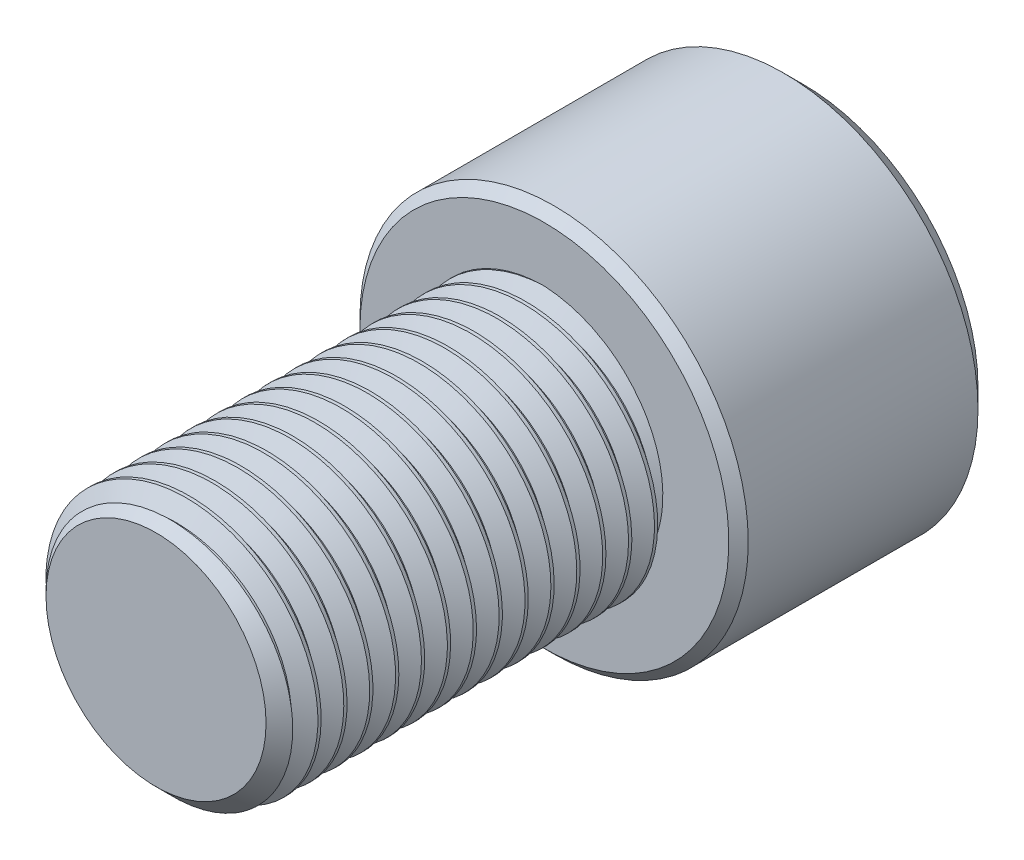
from build123d import *

# Parameters (mm, degrees)
SKETCH1_R          = 6.35
EXTRUDE1_DEPTH     = 19.05
CHAMFER3_SIZE      = 0.9525
CUT_SWEEP1_PITCH   = 1.27
SKETCH6_R          = 9.525
EXTRUDE2_DEPTH     = 12.7
CUT_EXTRUDE1_DEPTH = 7.14375
CHAMFER1_SIZE      = 0.9525
CHAMFER2_SIZE      = 0.47625


with BuildPart() as part:
    # Sketch1 → Extrude1 (new body)
    with BuildSketch(Plane.XY):
        Circle(SKETCH1_R)
    extrude(amount=-EXTRUDE1_DEPTH)

    # Chamfer3
    chamfer3_edges = [part.edges().sort_by_distance(p)[0] for p in [
        (-6.35, 0, 0),
    ]]
    chamfer(chamfer3_edges, length=CHAMFER3_SIZE)

    # Cut-Sweep1: the profile of Sketch3 profile screwed along a right-hand helix of 16 turns, 6 arcs to a turn; built about Z, then put on its axis
    cut_sweep1_z = Axis((0, 0, 0), (0, 0, 1))
    cut_sweep1_corners = [(6.3503, 0, -1.111423205), (5.525110803, 0, -0.635), (5.525110803, 0, -0.47625), (6.3503, 0, 0.000173205)]
    with BuildLine(mode=Mode.PRIVATE) as cut_sweep1_profile:
        Line(cut_sweep1_corners[0], cut_sweep1_corners[1])
        Line(cut_sweep1_corners[1], cut_sweep1_corners[2])
        Line(cut_sweep1_corners[2], cut_sweep1_corners[3])
        Line(cut_sweep1_corners[3], cut_sweep1_corners[0])
    cut_sweep1_cap = Face(cut_sweep1_profile.wire())
    cut_sweep1_turn_angles = [0, 30, 60, 90, 120, 150, 180, 210, 240, 270, 300, 330, 360]
    cut_sweep1_turn_weights = [1, 0.8660254037844387, 1, 0.8660254037844387, 1, 0.8660254037844387, 1, 0.8660254037844387, 1, 0.8660254037844387, 1, 0.8660254037844387, 1]
    cut_sweep1_turn_rails = [Edge.make_bspline([Vector(p[0], p[1], 0).rotate(cut_sweep1_z, cut_sweep1_turn_angles[k]) / cut_sweep1_turn_weights[k] + Vector(0, 0, p[2] + CUT_SWEEP1_PITCH * cut_sweep1_turn_angles[k] / 360) for k in range(13)], [0, 0, 0, 1, 1, 2, 2, 3, 3, 4, 4, 5, 5, 6, 6, 6], 2, cut_sweep1_turn_weights) for p in cut_sweep1_corners]
    cut_sweep1_turn_sides = [Face.make_surface_from_curves(cut_sweep1_turn_rails[p[0]], cut_sweep1_turn_rails[p[1]]) for p in [(0, 1), (1, 2), (2, 3), (3, 0)]]
    cut_sweep1 = Plane(origin=(0, 0, 0), x_dir=(0, 1, 0), z_dir=(0, 0, -1)) * Solid(Shell([*[p.moved(Location((0, 0, CUT_SWEEP1_PITCH * i))) for i in range(16) for p in cut_sweep1_turn_sides], cut_sweep1_cap, cut_sweep1_cap.rotate(cut_sweep1_z, 5760).moved(Location((0, 0, CUT_SWEEP1_PITCH * 5760 / 360)))]))
    add(cut_sweep1, mode=Mode.SUBTRACT)

    # Sketch6 → Extrude2 (add)
    with BuildSketch(Plane(origin=(0, 0, -19.05), x_dir=(-1, 0, 0), z_dir=(0, 0, -1))):
        Circle(SKETCH6_R)
    extrude(amount=EXTRUDE2_DEPTH)

    # Sketch7 → Cut-Extrude1 (cut)
    with BuildSketch(Plane(origin=(0, 0, -31.75), x_dir=(-1, 0, 0), z_dir=(0, 0, -1))):
        Polygon((0, 5.499261314), (-4.7625, 2.749630657), (-4.7625, -2.749630657), (0, -5.499261314), (4.7625, -2.749630657), (4.7625, 2.749630657), align=None)
    extrude(amount=-CUT_EXTRUDE1_DEPTH, mode=Mode.SUBTRACT)

    # Cut-Extrude2 cone 1 section (through the dimple's axis) → Cut-Extrude2 (revolve, cut)
    with BuildSketch(Plane(origin=(0, 0, -31.75), x_dir=(0, 1, 0), z_dir=(1, 0, 0))):
        Polygon((0, 0), (5.499261314, 0), (0, 5.499261314), align=None)
    revolve(axis=Axis((0, 0, -31.75), (0, 0, 1)), mode=Mode.SUBTRACT)

    # Chamfer1
    chamfer1_edges = [part.edges().sort_by_distance(p)[0] for p in [
        (9.525, 0, -31.75),
    ]]
    chamfer(chamfer1_edges, length=CHAMFER1_SIZE)

    # Chamfer2
    chamfer2_edges = [part.edges().sort_by_distance(p)[0] for p in [
        (9.525, 0, -19.05),
    ]]
    chamfer(chamfer2_edges, length=CHAMFER2_SIZE)


solid = part.part
